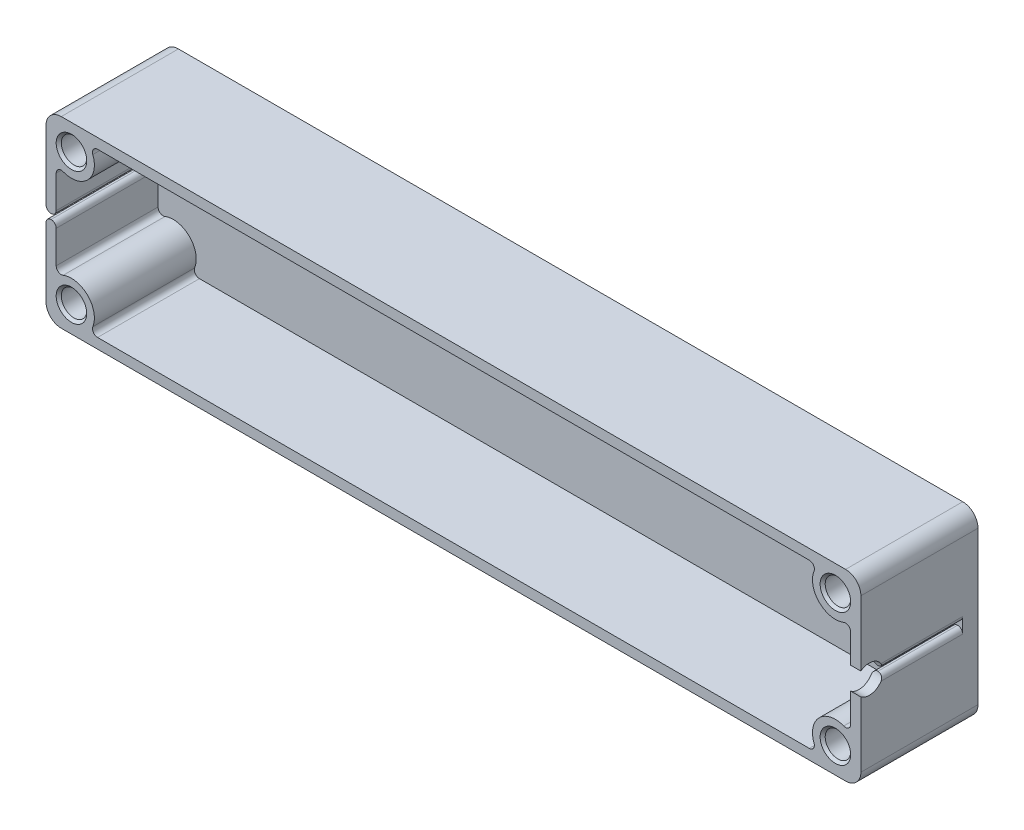
from build123d import *

# Parameters (mm, degrees)
SKETCH1_W                       = 160
SKETCH1_H                       = 36
BOSS_EXTRUDE1_DEPTH             = 3
SKETCH3_W                       = 160
SKETCH3_H                       = 36
SKETCH3_W_2                     = 156
SKETCH3_H_2                     = 32
BOSS_EXTRUDE3_DEPTH             = 20
SKETCH4_W                       = 2
SKETCH4_H                       = 1
CUT_EXTRUDE1_DEPTH              = 20
SKETCH5_R                       = 4.5
BOSS_EXTRUDE4_DEPTH             = 20
F_5_0MM_DOWEL_HOLE1_D           = 5
F_5_0MM_DOWEL_HOLE1_DEPTH       = 4.6
F_5_0MM_DOWEL_HOLE1_CSINK_D     = 6
F_5_0MM_DOWEL_HOLE1_CSINK_ANGLE = 90
FILLET3_R                       = 3
M5_CLEARANCE_HOLE2_D            = 5.5
FILLET4_R                       = 1
M5_CLEARANCE_HOLE3_D            = 5.5
M5_CLEARANCE_HOLE3_DEPTH        = 10
M5_CLEARANCE_HOLE3_TIP          = 1.652366702


with BuildPart() as part:
    # Sketch1 → Boss-Extrude1 (new body)
    with BuildSketch(Plane.XY):
        Rectangle(SKETCH1_W, SKETCH1_H)
    extrude(amount=BOSS_EXTRUDE1_DEPTH)

    # Sketch3 → Boss-Extrude3 (add)
    with BuildSketch(Plane.XY.offset(3)):
        Rectangle(SKETCH3_W, SKETCH3_H)
        Rectangle(SKETCH3_W_2, SKETCH3_H_2, mode=Mode.SUBTRACT)
    extrude(amount=BOSS_EXTRUDE3_DEPTH)

    # Sketch4 → Cut-Extrude1 (cut)
    with BuildSketch(Plane.XY.offset(23)):
        with Locations((79, 0)):
            Rectangle(SKETCH4_W, SKETCH4_H)
    cut_extrude1 = extrude(amount=-CUT_EXTRUDE1_DEPTH, mode=Mode.SUBTRACT)

    # Sketch5 → Boss-Extrude4 (add)
    with BuildSketch(Plane.XY.offset(3)):
        with Locations((75, 13)):
            Circle(SKETCH5_R)
        with Locations((75, -13)):
            Circle(SKETCH5_R)
    boss_extrude4 = extrude(amount=BOSS_EXTRUDE4_DEPTH)

    # Ø5.0mm Dowel Hole1
    with Locations(Plane.XY.offset(23)):
        with Locations((75, 13), (75, -13)):
            f_5_0mm_dowel_hole1 = CounterSinkHole(F_5_0MM_DOWEL_HOLE1_D / 2, F_5_0MM_DOWEL_HOLE1_CSINK_D / 2, depth=F_5_0MM_DOWEL_HOLE1_DEPTH, counter_sink_angle=F_5_0MM_DOWEL_HOLE1_CSINK_ANGLE)

    # Fillet3
    fillet3_edges = [part.edges().sort_by_distance(p)[0] for p in [
        (-80, 18, 11.5),
        (80, 18, 11.5),
        (80, -18, 11.5),
        (-80, -18, 11.5),
    ]]
    fillet(fillet3_edges, radius=FILLET3_R)

    # M5 Clearance Hole2 (through all)
    with Locations(Plane(origin=(0, 0, 0), x_dir=(-1, 0, 0), z_dir=(0, 0, -1))):
        with Locations((-70, 0), (70, 0)):
            m5_clearance_hole2 = Hole(M5_CLEARANCE_HOLE2_D / 2)

    # Mirror2: Cut-Extrude1, Boss-Extrude4, Ø5.0mm Dowel Hole1, M5 Clearance Hole2 across plane
    add(cut_extrude1.mirror(Plane(origin=(0, 0, 0), x_dir=(0, 0, 1), z_dir=(1, 0, 0))), mode=Mode.SUBTRACT)
    add(boss_extrude4.mirror(Plane(origin=(0, 0, 0), x_dir=(0, 0, 1), z_dir=(1, 0, 0))))
    add(f_5_0mm_dowel_hole1.mirror(Plane(origin=(0, 0, 0), x_dir=(0, 0, 1), z_dir=(1, 0, 0))), mode=Mode.SUBTRACT)
    add(m5_clearance_hole2.mirror(Plane(origin=(0, 0, 0), x_dir=(0, 0, 1), z_dir=(1, 0, 0))), mode=Mode.SUBTRACT)

    # Fillet4
    fillet4_edges = [part.edges().sort_by_distance(p)[0] for p in [
        (-78, -9.645898034, 13),
        (-78, -0.5, 13),
        (-80, -0.5, 13),
        (-80, 0.5, 13),
        (-78, 0.5, 13),
        (-78, 9.645898034, 13),
        (-71.645898034, 16, 13),
        (71.645898034, 16, 13),
        (78, 0.5, 13),
        (80, 0.5, 13),
        (80, -0.5, 13),
        (78, -0.5, 13),
        (78, -9.645898034, 13),
        (71.645898034, -16, 13),
        (-71.645898034, -16, 13),
        (78, 9.645898034, 13),
    ]]
    fillet(fillet4_edges, radius=FILLET4_R - 0.0001)  # a hair under: the kernel refuses the full size

    # M5 Clearance Hole3
    with Locations(Plane(origin=(80, 0, 0), x_dir=(0, 0, -1), z_dir=(1, 0, 0))):
        with Locations((-21.351359234, 0)):
            Hole(M5_CLEARANCE_HOLE3_D / 2, depth=M5_CLEARANCE_HOLE3_DEPTH)
            with Locations((0, 0, -(M5_CLEARANCE_HOLE3_DEPTH + M5_CLEARANCE_HOLE3_TIP / 2))):  # 118° drill point
                Cone(0, M5_CLEARANCE_HOLE3_D / 2, M5_CLEARANCE_HOLE3_TIP, mode=Mode.SUBTRACT)


solid = part.part
